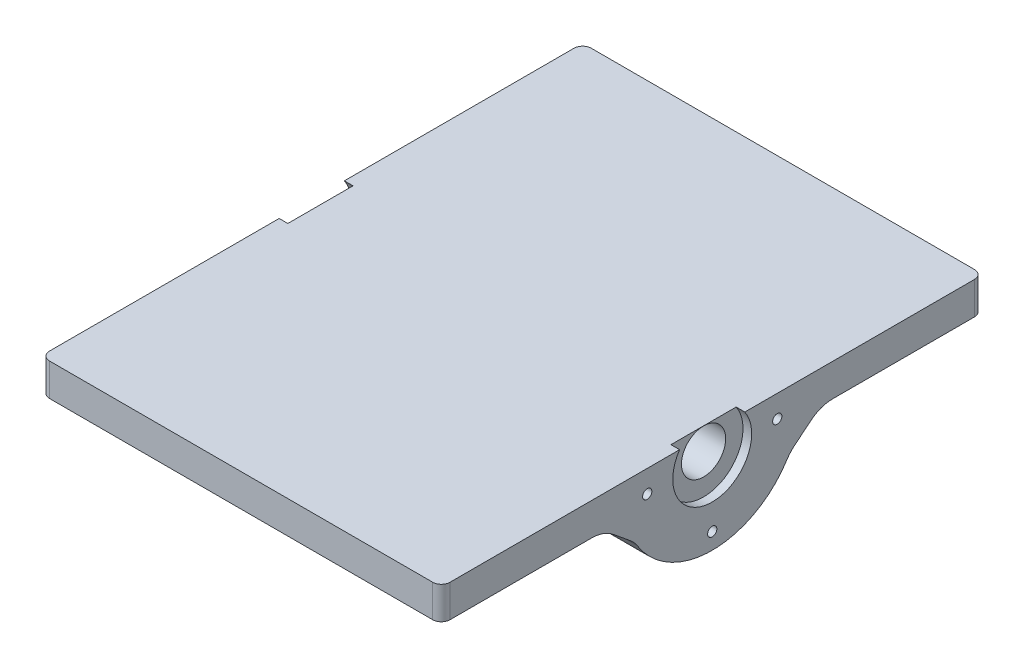
from build123d import *

# Parameters (mm, degrees)
SKETCH1_W           = 117.348
SKETCH1_H           = 38.1
BOSS_EXTRUDE1_DEPTH = 158.75
SKETCH2_R           = 1.35255
CUT_EXTRUDE1_DEPTH  = 152.4
SKETCH3_R           = 6.477
CUT_EXTRUDE4_DEPTH  = 154.686
SKETCH4_R           = 11.557
CUT_EXTRUDE5_DEPTH  = 2.54
CUT_EXTRUDE6_DEPTH  = 254
CHAMFER1_SIZE       = 6.35
FILLET1_R           = 10
FILLET2_R           = 2.54


with BuildPart() as part:
    # Sketch1 → Boss-Extrude1 (new body)
    with BuildSketch(Plane.XY):
        with Locations((-58.674, -19.05)):
            Rectangle(SKETCH1_W, SKETCH1_H)
    extrude(amount=BOSS_EXTRUDE1_DEPTH)

    # Sketch2 → Cut-Extrude1 (cut)
    with BuildSketch(Plane(origin=(0, 0, 0), x_dir=(0, 0, -1), z_dir=(1, 0, 0))):
        with Locations(Location((-98.425, -6.5024, 0), (0, 0, 90))):
            Circle(SKETCH2_R)
        with BuildLine():
            ThreePointArc((-78.02245, -25.5524), (-78.418602723, -24.596002723), (-79.375, -24.19985))
            Line((-79.375, -24.19985), (-79.375, -26.90495))
            ThreePointArc((-79.375, -26.90495), (-78.418602723, -26.508797277), (-78.02245, -25.5524))
        make_face()
        with BuildLine():
            Line((-79.375, -26.90495), (-79.375, -24.19985))
            ThreePointArc((-79.375, -24.19985), (-80.72755, -25.5524), (-79.375, -26.90495))
        make_face()
        with Locations(Location((-60.325, -6.5024, 0), (0, 0, 90))):
            Circle(SKETCH2_R)
    extrude(amount=-CUT_EXTRUDE1_DEPTH, mode=Mode.SUBTRACT)

    # Sketch3 → Cut-Extrude4 (cut)
    with BuildSketch(Plane(origin=(0, 0, 0), x_dir=(0, 0, -1), z_dir=(1, 0, 0))):
        with Locations(Location((-79.375, -6.5024, 0), (0, 0, 90))):
            Circle(SKETCH3_R)
    extrude(amount=-CUT_EXTRUDE4_DEPTH, mode=Mode.SUBTRACT)

    # Sketch4 → Cut-Extrude5 (cut)
    with BuildSketch(Plane(origin=(0, 0, 0), x_dir=(0, 0, -1), z_dir=(1, 0, 0))):
        with Locations((-79.375, -6.5024)):
            Circle(SKETCH4_R)
    cut_extrude5 = extrude(amount=-CUT_EXTRUDE5_DEPTH, mode=Mode.SUBTRACT)

    # Mirror1: Cut-Extrude5 across plane
    add(cut_extrude5.mirror(Plane(origin=(-58.674, 0, 0), x_dir=(0, 0, 1), z_dir=(1, 0, 0))), mode=Mode.SUBTRACT)

    # Sketch5 → Cut-Extrude6 (cut)
    with BuildSketch(Plane(origin=(0, 0, 0), x_dir=(0, 0, -1), z_dir=(1, 0, 0))):
        with BuildLine():
            Line((-158.75, -9.525), (-104.775, -9.525))
            ThreePointArc((-104.775, -9.525), (-79.375, -30.327663184), (-53.975, -9.525))
            Line((-53.975, -9.525), (0, -9.525))
            Line((0, -9.525), (0, -59.754484856))
            Line((0, -59.754484856), (-158.75, -59.754484856))
            Line((-158.75, -59.754484856), (-158.75, -9.525))
        make_face()
    extrude(amount=-CUT_EXTRUDE6_DEPTH, mode=Mode.SUBTRACT)

    # Chamfer1
    # the kernel refuses this chamfer: 6.35 mm, written as the material it adds along each edge
    with BuildSketch(Plane(origin=(0, -9.525, 104.775), x_dir=(0, -0.938739264670919, -0.3446281952555571), z_dir=(-1, 0, 0))) as chamfer1_piece_1:
        with BuildLine():
            Line((7.921952063, 0), (-CHAMFER1_SIZE * 0.344628195256, CHAMFER1_SIZE * 0.938739264671))
            Line((-CHAMFER1_SIZE * 0.344628195256, CHAMFER1_SIZE * 0.938739264671), (0, 0))
            ThreePointArc((0, 0), (4.071956682, 0.304341963), (7.921952063, 0))
        make_face()
    extrude(amount=117.348)
    with BuildSketch(Plane(origin=(0, -9.525, 53.975), x_dir=(0, 0, -1), z_dir=(-1, 0, 0))) as chamfer1_piece_2:
        with BuildLine():
            Line((CHAMFER1_SIZE, 0), (-2.730128042, 7.436647454))
            ThreePointArc((-2.730128042, 7.436647454), (-1.117613332, 3.927390442), (0, 0))
            Line((0, 0), (CHAMFER1_SIZE, 0))
        make_face()
    extrude(amount=117.348)

    # Fillet1
    fillet1_edges = [part.edges().sort_by_distance(p)[0] for p in [
        (-58.674, -9.525, 111.125),
        (-58.674, -16.961647454, 56.705128042),
        (-58.674, -16.961647454, 102.044871958),
        (-58.674, -9.525, 47.625),
    ]]
    fillet(fillet1_edges, radius=FILLET1_R)

    # Fillet2
    fillet2_edges = [part.edges().sort_by_distance(p)[0] for p in [
        (-117.348, -4.7625, 158.75),
        (-117.348, -4.7625, 0),
        (0, -4.7625, 0),
        (0, -4.7625, 158.75),
    ]]
    fillet(fillet2_edges, radius=FILLET2_R)


solid = part.part
